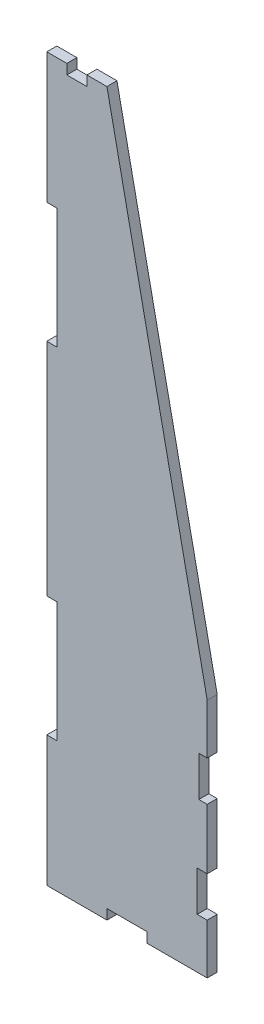
from build123d import *

# Parameters (mm, degrees)
BOSS_EXTRUDE3_DEPTH = 6.35
SKETCH2_W           = 12.7
SKETCH2_H           = 6.35
SKETCH2_W_2         = 6.35
SKETCH2_H_2         = 76.2
SKETCH2_W_3         = 25.4
SKETCH2_H_3         = 25.4
CUT_EXTRUDE1_DEPTH  = 770.479452425
SKETCH3_W           = 6.35
SKETCH3_H           = 25.4
CUT_EXTRUDE2_DEPTH  = 770.479452425


with BuildPart() as part:
    # Sketch1 → Boss-Extrude3 (new body)
    with BuildSketch(Plane.XY):
        Polygon((359.319883673, 642.86985555), (422.819883673, 338.06985555), (422.819883673, 185.66985555), (321.219883673, 185.66985555), (321.219883673, 642.86985555), align=None)
    extrude(amount=BOSS_EXTRUDE3_DEPTH)

    # Sketch2 → Cut-Extrude1 (cut, through all)
    with BuildSketch(Plane.XY.offset(6.35)):
        with Locations((340.269883673, 639.69485555)):
            Rectangle(SKETCH2_W, SKETCH2_H)
        with Locations((324.394883673, 522.21985555)):
            Rectangle(SKETCH2_W_2, SKETCH2_H_2)
        with Locations((324.394883673, 306.31985555)):
            Rectangle(SKETCH2_W_2, SKETCH2_H_2)
        with Locations((372.019883673, 188.84485555)):
            Rectangle(SKETCH2_W_3, SKETCH2_H)
        with Locations((419.644883673, 230.11985555)):
            Rectangle(SKETCH2_W_2, SKETCH2_H_3)
    extrude(amount=-CUT_EXTRUDE1_DEPTH, mode=Mode.SUBTRACT)

    # Sketch3 → Cut-Extrude2 (cut, through all)
    with BuildSketch(Plane.XY):
        with Locations((420.687257615, 293.61985555)):
            Rectangle(SKETCH3_W, SKETCH3_H)
    extrude(amount=CUT_EXTRUDE2_DEPTH, mode=Mode.SUBTRACT)


solid = part.part
